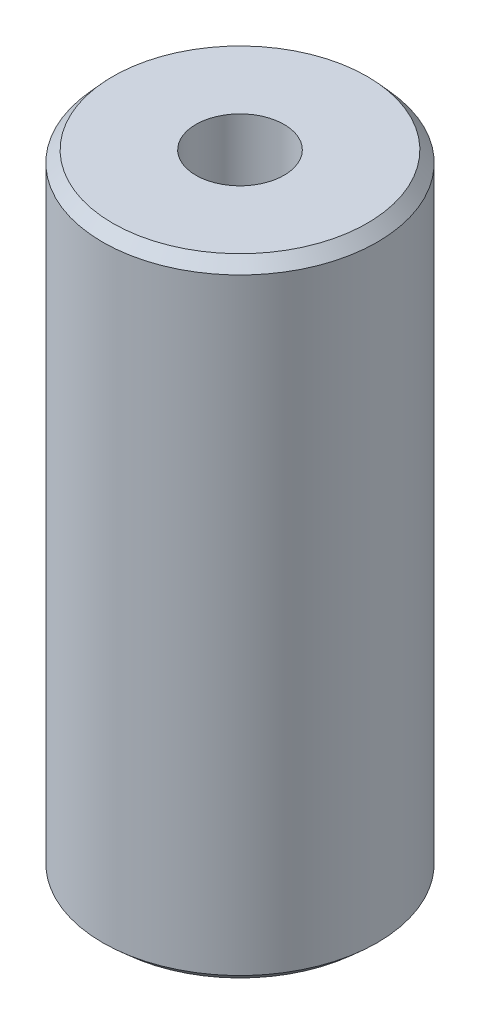
from build123d import *
from OCP.BRepFilletAPI import BRepFilletAPI_MakeChamfer

# Parameters (mm, degrees)
SKETCH1_R           = 7.5
BOSS_EXTRUDE1_DEPTH = 34.30346978
SKETCH2_R           = 2.4085398
CUT_EXTRUDE1_DEPTH  = 36.905821798
CHAMFER1_SIZE       = 0.616358342
CHAMFER1_SIZE2      = 0.551504151


with BuildPart() as part:
    # Sketch1 → Boss-Extrude1 (new body)
    with BuildSketch(Plane(origin=(0, 0, 0), x_dir=(1, 0, 0), z_dir=(0, 1, 0))):
        Circle(SKETCH1_R)
    extrude(amount=BOSS_EXTRUDE1_DEPTH)

    # Sketch2 → Cut-Extrude1 (cut, through all)
    with BuildSketch(Plane(origin=(0, 0, 0), x_dir=(1, 0, 0), z_dir=(0, 1, 0))):
        Circle(SKETCH2_R)
    extrude(amount=CUT_EXTRUDE1_DEPTH, mode=Mode.SUBTRACT)

    # Chamfer1: one chamfer whose edges measure the first distance from different faces: ONE call of the kernel's chamfer builder (chamfer() names one face for all edges)
    chamfer1_edges_1 = [part.edges().sort_by_distance(p)[0] for p in [
        (-7.5, 34.30346978, 0),
    ]]
    chamfer1_side_1 = [part.faces().sort_by_distance(p)[0] for p in [
        (-7.5, 17.15173489, 0),
    ]]
    chamfer1_edges_2 = [part.edges().sort_by_distance(p)[0] for p in [
        (-7.5, 0, 0),
    ]]
    chamfer1_side_2 = [part.faces().sort_by_distance(p)[0] for p in [
        (-7.287867966, 0, 0),
    ]]
    chamfer1 = BRepFilletAPI_MakeChamfer(part.part.solid().wrapped)
    for e in chamfer1_edges_1:
        chamfer1.Add(CHAMFER1_SIZE, CHAMFER1_SIZE2, e.wrapped, chamfer1_side_1[0].wrapped)  # the first distance lies on this face
    for e in chamfer1_edges_2:
        chamfer1.Add(CHAMFER1_SIZE, CHAMFER1_SIZE2, e.wrapped, chamfer1_side_2[0].wrapped)  # the first distance lies on this face
    add(Compound.cast(chamfer1.Shape()), mode=Mode.REPLACE)


solid = part.part
